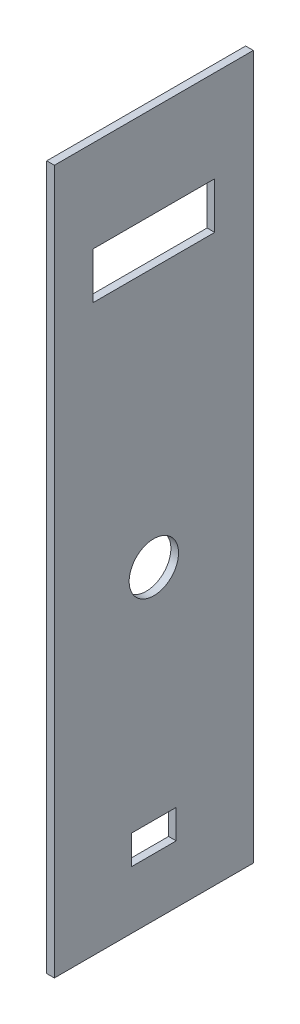
from build123d import *

# Parameters (mm, degrees)
SKETCH1_W           = 82.55
SKETCH1_H           = 292.1
BOSS_EXTRUDE1_DEPTH = 3.175
CUT_EXTRUDE1_REACH  = 305.557
SKETCH2_W           = 50.546
SKETCH2_H           = 19.304
CUT_EXTRUDE2_REACH  = 305.557
SKETCH4_R           = 10.25
CUT_EXTRUDE3_REACH  = 305.557
SKETCH5_W           = 18.6
SKETCH5_H           = 12.05


with BuildPart() as part:
    # Sketch1 → Boss-Extrude1 (new body)
    with BuildSketch(Plane(origin=(0, 0, 0), x_dir=(0, 0, -1), z_dir=(1, 0, 0))):
        with Locations((41.275, 146.05)):
            Rectangle(SKETCH1_W, SKETCH1_H)
    extrude(amount=BOSS_EXTRUDE1_DEPTH)

    # Sketch2 → Cut-Extrude1 (cut, up to next)
    with BuildSketch(Plane.ZY, mode=Mode.PRIVATE) as cut_extrude1_sk1:
        with Locations((-41.275, 244.348)):
            Rectangle(SKETCH2_W, SKETCH2_H)
    cut_extrude1_tool1 = extrude(cut_extrude1_sk1.sketch, amount=-CUT_EXTRUDE1_REACH, mode=Mode.PRIVATE) & part.part
    add(cut_extrude1_tool1.solids().sort_by_distance((0, 244.348, -41.275))[0], mode=Mode.SUBTRACT)

    # Sketch4 → Cut-Extrude2 (cut, up to next)
    with BuildSketch(Plane.ZY, mode=Mode.PRIVATE) as cut_extrude2_sk1:
        with Locations((-41.275, 127)):
            Circle(SKETCH4_R)
    cut_extrude2_tool1 = extrude(cut_extrude2_sk1.sketch, amount=-CUT_EXTRUDE2_REACH, mode=Mode.PRIVATE) & part.part
    add(cut_extrude2_tool1.solids().sort_by_distance((0, 127, -41.275))[0], mode=Mode.SUBTRACT)

    # Sketch5 → Cut-Extrude3 (cut, up to next)
    with BuildSketch(Plane.ZY, mode=Mode.PRIVATE) as cut_extrude3_sk1:
        with Locations((-41.275, 30.025)):
            Rectangle(SKETCH5_W, SKETCH5_H)
    cut_extrude3_tool1 = extrude(cut_extrude3_sk1.sketch, amount=-CUT_EXTRUDE3_REACH, mode=Mode.PRIVATE) & part.part
    add(cut_extrude3_tool1.solids().sort_by_distance((0, 30.025, -41.275))[0], mode=Mode.SUBTRACT)


solid = part.part
